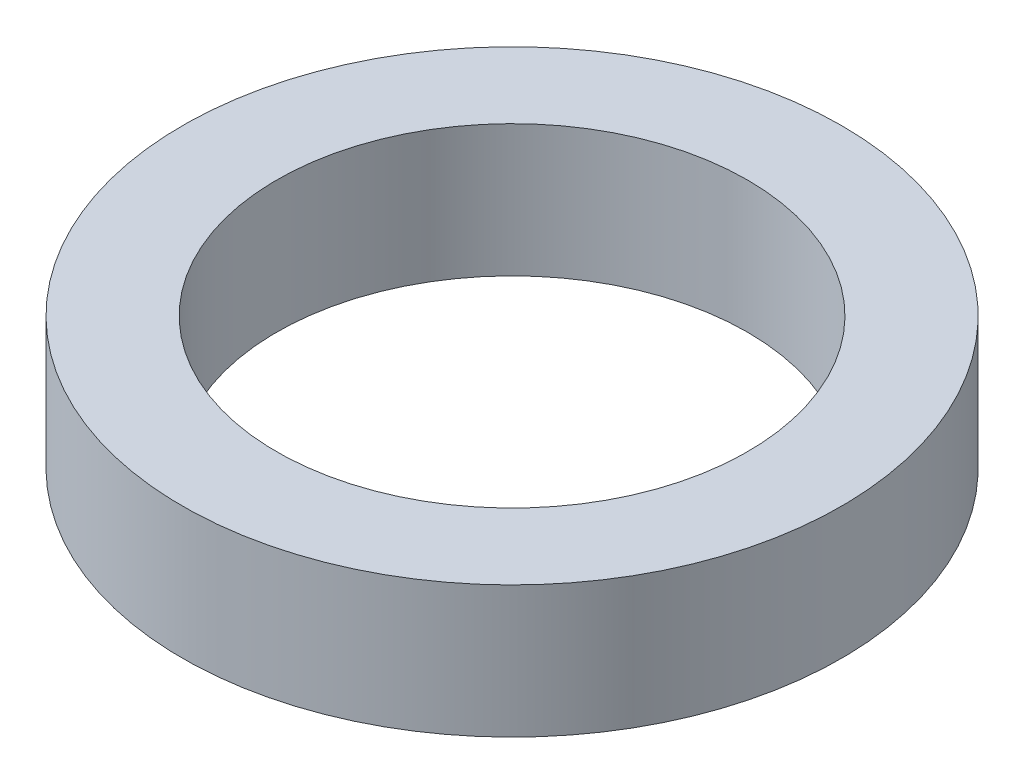
from build123d import *

# Parameters (mm, degrees)
SKETCH1_R           = 52.5
BOSS_EXTRUDE1_DEPTH = 21
SKETCH2_R           = 37.5
CUT_EXTRUDE1_DEPTH  = 78.158926898


with BuildPart() as part:
    # Sketch1 → Boss-Extrude1 (new body)
    with BuildSketch(Plane(origin=(0, 0, 0), x_dir=(1, 0, 0), z_dir=(0, 1, 0))):
        Circle(SKETCH1_R)
    extrude(amount=BOSS_EXTRUDE1_DEPTH)

    # Sketch2 → Cut-Extrude1 (cut, through all)
    with BuildSketch(Plane(origin=(0, 0, 0), x_dir=(1, 0, 0), z_dir=(0, 1, 0))):
        Circle(SKETCH2_R)
    extrude(amount=CUT_EXTRUDE1_DEPTH, mode=Mode.SUBTRACT)


solid = part.part
